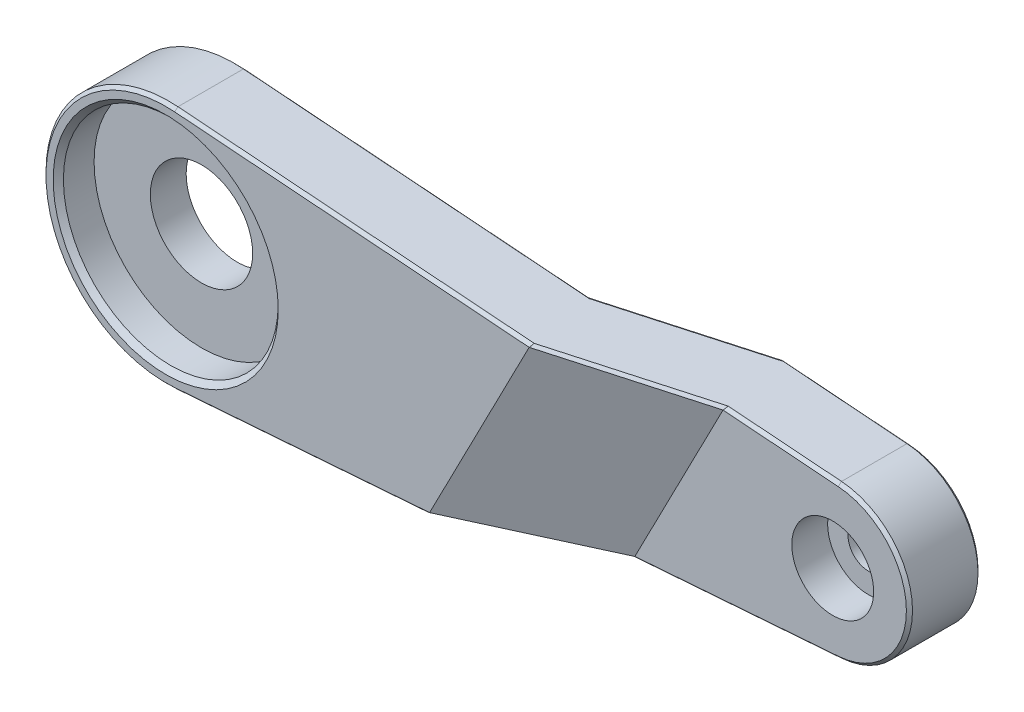
from build123d import *

# Parameters (mm, degrees)
EXTRUDE_1_DEPTH     = 7
SKETCH_2_R          = 10.5
CUT_EXTRUDE_1_DEPTH = 3.5
SKETCH_3_R          = 5
CUT_EXTRUDE_2_DEPTH = 69.914802474
EXTRUDE_START       = 5.2
EXTRUDE_2_DEPTH     = 5.2
CUT_EXTRUDE_START   = -10.220454921
CUT_EXTRUDE_3_DEPTH = 45.240565609
CHAMFER_1_SIZE      = 0.5
CHAMFER_2_SIZE      = 0.3
CHAMFER_3_SIZE      = 0.3
CHAMFER_3_SIZE_2    = 0.254518099
CHAMFER_3_SIZE_3    = 0.383899621
CHAMFER_3_SIZE_4    = 0.356772393
CHAMFER_3_SIZE_5    = 0.263835418


with BuildPart() as part:
    # 草图1 → 凸台-拉伸1 (new body)
    with BuildSketch(Plane.XY):
        with BuildLine():
            Line((0.9, -11.966202405), (60.5625, -7.478876503))
            ThreePointArc((60.5625, -7.478876503), (67.5, 0), (60.5625, 7.478876503))
            Line((60.5625, 7.478876503), (0.9, 11.966202405))
            ThreePointArc((0.9, 11.966202405), (-12, 0), (0.9, -11.966202405))
        make_face()
    extrude(amount=EXTRUDE_1_DEPTH)

    # 草图2 → 切除-拉伸1 (cut)
    with BuildSketch(Plane.XY.offset(7)):
        Circle(SKETCH_2_R)
    extrude(amount=-CUT_EXTRUDE_1_DEPTH, mode=Mode.SUBTRACT)

    # 草图3 → 切除-拉伸2 (cut, through all)
    with BuildSketch(Plane(origin=(0, 0, 0), x_dir=(-1, 0, 0), z_dir=(0, 0, -1))):
        Circle(SKETCH_3_R)
    extrude(amount=-CUT_EXTRUDE_2_DEPTH, mode=Mode.SUBTRACT)

    # 草图4 → 凸台-拉伸2 (add)
    with BuildSketch(Plane(origin=(0, 0, 0), x_dir=(-1, 0, 0), z_dir=(0, 0, -1)).offset(EXTRUDE_START)):
        with BuildLine():
            Line((-24.349176843, -10.202546866), (-34.487976367, 9.439989183))
            Line((-34.487976367, 9.439989183), (-60.5625, 7.478876503))
            ThreePointArc((-60.5625, 7.478876503), (-67.5, 0), (-60.5625, -7.478876503))
            Line((-60.5625, -7.478876503), (-24.349176843, -10.202546866))
        make_face()
    extrude(amount=-EXTRUDE_2_DEPTH)

    # 切除-拉伸3: read off the stored shape, not the designer's step
    # 切除-拉伸3 outline → 切除-拉伸3 (cut)
    with BuildSketch(Plane(origin=(0, 0, 0), x_dir=(0.8886074479712769, -0.45866851146549686, 0), z_dir=(0.45866851146549686, 0.8886074479712767, 0)).offset(CUT_EXTRUDE_START)):
        Polygon((26.316446878, 5.2), (26.316446878, 0), (39.011877148, 5.2), align=None)
        Polygon((62, -7), (62, -1.8), (40.108675427, -1.8), (27.413245157, -7), align=None)
    extrude(amount=CUT_EXTRUDE_3_DEPTH, mode=Mode.SUBTRACT)

    # 草图6 → 切除-旋转1 (revolve, cut)
    with BuildSketch(Plane(origin=(0, 0, 0), x_dir=(1, 0, 0), z_dir=(0, 1, 0))):
        Polygon((60, 5.2), (58, 5.2), (58, 1.7), (56, 1.7), (56, -1.8), (60, -1.8), align=None)
    revolve(axis=Axis((60, 0, -13.45), (0, 0, 1)), mode=Mode.SUBTRACT)

    # 倒角1
    chamfer_1_edges = [part.edges().sort_by_distance(p)[0] for p in [
        (-10.5, 0, 7),
    ]]
    chamfer(chamfer_1_edges, length=CHAMFER_1_SIZE)

    # 倒角2
    chamfer_2_edges = [part.edges().sort_by_distance(p)[0] for p in [
        (62, 0, -5.2),
    ]]
    chamfer(chamfer_2_edges, length=CHAMFER_2_SIZE)

    # 倒角3
    # the kernel refuses this chamfer: 0.383899621, 0.356772393, 0.3, 0.263835418, 0.254518099 mm, written as the material it takes off along each edge
    with BuildSketch(Plane(origin=(60.5625, -7.478876503, -5.2), x_dir=(-0.07499999999999998, 0.9971835337589565, 0), z_dir=(-0.9971835337589565, -0.07499999999999998, 0))) as chamfer_3_piece_1:
        Polygon((CHAMFER_3_SIZE, 0), (0, -CHAMFER_3_SIZE), (0, 0), align=None)
    extrude(amount=22.721254915, mode=Mode.SUBTRACT)
    with BuildSketch(Plane(origin=(60, 0, -5.2), x_dir=(0.07499999999999998, 0.9971835337589565, 0), z_dir=(-0.9971835337589565, 0.07499999999999998, 0))) as chamfer_3_piece_2:
        Polygon((7.5 - CHAMFER_3_SIZE, 0), (7.5, -CHAMFER_3_SIZE), (7.5, 0), align=None)
    revolve(axis=Axis((60, 0, -5.2), (0, 0, -1)), revolution_arc=171.397555391, mode=Mode.SUBTRACT)
    with BuildSketch(Plane(origin=(46.933080248, 8.503970126, -5.2), x_dir=(-0.07499999999999997, -0.9971835337589565, 0), z_dir=(0.9971835337589565, -0.07499999999999997, 0))) as chamfer_3_piece_3:
        Polygon((CHAMFER_3_SIZE, 0), (0, -CHAMFER_3_SIZE), (0, 0), align=None)
    extrude(amount=13.667914973, mode=Mode.SUBTRACT)
    # the kernel refuses this chamfer: 0.383899621, 0.356772393, 0.3, 0.263835418, 0.254518099 mm, written as the material it takes off along each edge
    with BuildSketch(Plane(origin=(0.9, -11.966202405, 0), x_dir=(-0.07499999999999997, 0.9971835337589565, 0), z_dir=(0.9971835337589566, 0.07499999999999997, 0))) as chamfer_3_2_piece_1_section:
        Polygon((CHAMFER_3_SIZE, 0), (0, CHAMFER_3_SIZE), (0, 0), align=None)
    chamfer_3_2_piece_1 = extrude(amount=24.286912089, mode=Mode.PRIVATE)
    chamfer_3_2_piece_1 = split(chamfer_3_2_piece_1, bisect_by=Plane(origin=(3.45685625, -13.285963401, 7.024904811), z_dir=(-0.33681186979171107, 0.17385066860959783, -0.9253830068633244)), keep=Keep.TOP, mode=Mode.PRIVATE)
    add(chamfer_3_2_piece_1, mode=Mode.SUBTRACT)
    with BuildSketch(Plane(origin=(35.257308346, 9.382126316, 0), x_dir=(0, 0, 1), z_dir=(-0.9971835337589566, 0.075, 0))) as chamfer_3_2_piece_2_section:
        Polygon((CHAMFER_3_SIZE, 0), (0, -CHAMFER_3_SIZE), (0, 0), align=None)
    chamfer_3_2_piece_2 = extrude(amount=34.454347854, mode=Mode.PRIVATE)
    chamfer_3_2_piece_2 = split(chamfer_3_2_piece_2, bisect_by=Plane(origin=(35.166645448, 9.428923377, -0.249094265), z_dir=(-0.33681186979171107, 0.17385066860959783, -0.9253830068633244)), keep=Keep.TOP, mode=Mode.PRIVATE)
    add(chamfer_3_2_piece_2, mode=Mode.SUBTRACT)
    with BuildSketch(Plane(origin=(0, 0, 0), x_dir=(0.07500000000000011, 0.9971835337589566, 0), z_dir=(0.9971835337589566, -0.07500000000000011, 0))) as chamfer_3_2_piece_3:
        Polygon((12 - CHAMFER_3_SIZE, 0), (12, CHAMFER_3_SIZE), (12, 0), align=None)
    revolve(axis=Axis((0, 0, 0), (0, 0, 1)), revolution_arc=188.602444609, mode=Mode.SUBTRACT)
    # the kernel refuses this chamfer: 0.383899621, 0.356772393, 0.3, 0.263835418, 0.254518099 mm, written as the material it takes off along each edge
    with BuildSketch(Plane(origin=(39.590447843, -9.056222958, -5.332010389), x_dir=(0.3284593891924205, 0.024704032262311923, 0.9441949695064703), z_dir=(-0.9415356762498924, -0.07081462271298539, 0.3293870968308798))) as chamfer_3_3_piece_1_section:
        Polygon((CHAMFER_3_SIZE_2 * 0.999999998644, 0), (CHAMFER_3_SIZE * 0.198621914305, CHAMFER_3_SIZE * 0.980076188446), (0, 0), align=None)
    chamfer_3_3_piece_1 = extrude(amount=17.869959702, mode=Mode.PRIVATE)
    chamfer_3_3_piece_1 = split(chamfer_3_3_piece_1, bisect_by=Plane(origin=(39.379247454, -6.248148947, -2.516005194), z_dir=(0.05303300858899107, -0.7051152388085232, -0.7071067811865471)), keep=Keep.TOP, mode=Mode.PRIVATE)
    add(chamfer_3_3_piece_1, mode=Mode.SUBTRACT)
    # the kernel refuses this chamfer: 0.383899621, 0.356772393, 0.3, 0.263835418, 0.254518099 mm, written as the material it takes off along each edge
    with BuildSketch(Plane(origin=(39.727912607, -9.045883981, 1.8), x_dir=(-0.07499999999999996, 0.9971835337589565, 0), z_dir=(0.9971835337589566, 0.07499999999999997, 0))) as chamfer_3_4_piece_1_section:
        Polygon((CHAMFER_3_SIZE, 0), (0, -CHAMFER_3_SIZE), (0, 0), align=None)
    chamfer_3_4_piece_1 = extrude(amount=20.893433042, mode=Mode.PRIVATE)
    chamfer_3_4_piece_1 = split(chamfer_3_4_piece_1, bisect_by=Plane(origin=(39.811799189, -9.089183341, 2.030476488), z_dir=(0.33681186979171107, -0.17385066860959783, 0.9253830068633244)), keep=Keep.TOP, mode=Mode.PRIVATE)
    add(chamfer_3_4_piece_1, mode=Mode.SUBTRACT)
    with BuildSketch(Plane(origin=(60, 0, 1.8), x_dir=(0.075, 0.9971835337589565, 0), z_dir=(-0.9971835337589565, 0.075, 0))) as chamfer_3_4_piece_2:
        Polygon((7.5 - CHAMFER_3_SIZE, 0), (7.5, CHAMFER_3_SIZE), (7.5, 0), align=None)
    revolve(axis=Axis((60, 0, 1.8), (0, 0, -1)), revolution_arc=171.397555391, mode=Mode.SUBTRACT)
    with BuildSketch(Plane(origin=(60.5625, 7.478876503, 1.8), x_dir=(-0.07499999999999998, -0.9971835337589565, 0), z_dir=(-0.9971835337589566, 0.075, 0))) as chamfer_3_4_piece_3_section:
        Polygon((CHAMFER_3_SIZE, 0), (0, -CHAMFER_3_SIZE), (0, 0), align=None)
    chamfer_3_4_piece_3 = extrude(amount=11.936343353, mode=Mode.PRIVATE)
    chamfer_3_4_piece_3 = split(chamfer_3_4_piece_3, bisect_by=Plane(origin=(59.250471243, 8.156100488, -1.804769384), z_dir=(0.33681186979171107, -0.17385066860959783, 0.9253830068633244)), keep=Keep.TOP, mode=Mode.PRIVATE)
    add(chamfer_3_4_piece_3, mode=Mode.SUBTRACT)
    # the kernel refuses this chamfer: 0.383899621, 0.356772393, 0.3, 0.263835418, 0.254518099 mm, written as the material it takes off along each edge
    with BuildSketch(Plane(origin=(42.288756392, -8.85327823, 1.173257023), x_dir=(-0.3284593891924201, -0.02470403226231695, -0.9441949695064704), z_dir=(-0.9415356762498924, -0.07081462271298539, 0.3293870968308797))) as chamfer_3_5_piece_1_section:
        Polygon((CHAMFER_3_SIZE_3 * 1.0000000011, 0), (-CHAMFER_3_SIZE * 0.198621914305, -CHAMFER_3_SIZE * 0.980076188446), (0, 0), align=None)
    chamfer_3_5_piece_1 = extrude(amount=19.376005008, mode=Mode.PRIVATE)
    chamfer_3_5_piece_1 = split(chamfer_3_5_piece_1, bisect_by=Plane(origin=(42.301009253, -9.016189588, 1.336628512), z_dir=(0.053033008588990585, -0.7051152388085168, 0.7071067811865535)), keep=Keep.TOP, mode=Mode.PRIVATE)
    add(chamfer_3_5_piece_1, mode=Mode.SUBTRACT)
    # the kernel refuses this chamfer: 0.383899621, 0.356772393, 0.3, 0.263835418, 0.254518099 mm, written as the material it takes off along each edge
    with BuildSketch(Plane(origin=(0.9, -11.966202405, 7), x_dir=(-0.07499999999999997, 0.9971835337589565, 0), z_dir=(0.9971835337589566, 0.07499999999999997, 0))) as chamfer_3_6_piece_1:
        Polygon((CHAMFER_3_SIZE, 0), (0, -CHAMFER_3_SIZE), (0, 0), align=None)
    extrude(amount=25.952193485, mode=Mode.SUBTRACT)
    with BuildSketch(Plane(origin=(36.984003052, 9.252258445, 7), x_dir=(-0.075, -0.9971835337589565, 0), z_dir=(-0.9971835337589566, 0.075, 0))) as chamfer_3_6_piece_2:
        Polygon((CHAMFER_3_SIZE, 0), (0, -CHAMFER_3_SIZE), (0, 0), align=None)
    extrude(amount=36.185919473, mode=Mode.SUBTRACT)
    with BuildSketch(Plane(origin=(0, 0, 7), x_dir=(0.07500000000000011, 0.9971835337589566, 0), z_dir=(0.9971835337589566, -0.07500000000000011, 0))) as chamfer_3_6_piece_3:
        Polygon((12 - CHAMFER_3_SIZE, 0), (12, -CHAMFER_3_SIZE), (12, 0), align=None)
    revolve(axis=Axis((0, 0, 7), (0, 0, 1)), revolution_arc=188.602444609, mode=Mode.SUBTRACT)
    # the kernel refuses this chamfer: 0.383899621, 0.356772393, 0.3, 0.263835418, 0.254518099 mm, written as the material it takes off along each edge
    with BuildSketch(Plane(origin=(32.83531163, 9.564289125, 0.624872862), x_dir=(-0.12627439013591127, -0.9822683171715932, -0.13857752875805598), z_dir=(0.9330662049196804, -0.07017761826168661, -0.3527925156971192))) as chamfer_3_7_piece_1_section:
        Polygon((CHAMFER_3_SIZE, 0), (-CHAMFER_3_SIZE_4 * 0.148100133729, -CHAMFER_3_SIZE_4 * 0.988972370164), (0, 0), align=None)
    chamfer_3_7_piece_1 = extrude(amount=17.22586636, mode=Mode.PRIVATE)
    chamfer_3_7_piece_1 = split(chamfer_3_7_piece_1, bisect_by=Plane(origin=(32.847494362, 9.72626806, 0.462436431), z_dir=(0.05303300858899109, 0.7051152388085231, -0.7071067811865475)), keep=Keep.TOP, mode=Mode.PRIVATE)
    add(chamfer_3_7_piece_1, mode=Mode.SUBTRACT)
    # the kernel refuses this chamfer: 0.383899621, 0.356772393, 0.3, 0.263835418, 0.254518099 mm, written as the material it takes off along each edge
    with BuildSketch(Plane(origin=(35.245808416, 9.382991247, 7.162707961), x_dir=(-0.351798887486564, 0.026459438677302174, -0.935701576822492), z_dir=(0.9330662049196804, -0.07017761826168642, -0.35279251569711917))) as chamfer_3_8_piece_1_section:
        Polygon((CHAMFER_3_SIZE_5 * 1.00000000141, 0), (CHAMFER_3_SIZE * 0.148100133836, -CHAMFER_3_SIZE * 0.988972370877), (0, 0), align=None)
    chamfer_3_8_piece_1 = extrude(amount=16.82260493, mode=Mode.PRIVATE)
    chamfer_3_8_piece_1 = split(chamfer_3_8_piece_1, bisect_by=Plane(origin=(35.033456868, 6.559611679, 4.33135398), z_dir=(0.05303300858899218, 0.7051152388085377, 0.7071067811865327)), keep=Keep.TOP, mode=Mode.PRIVATE)
    add(chamfer_3_8_piece_1, mode=Mode.SUBTRACT)


solid = part.part
